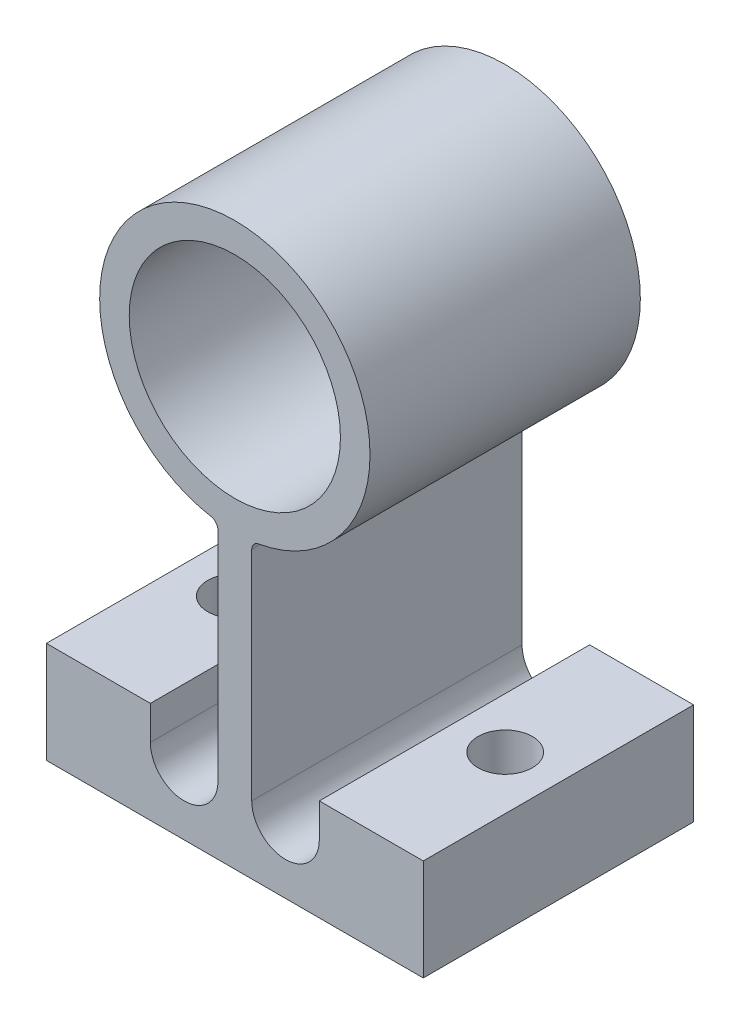
from build123d import *

# Parameters (mm, degrees)
SKETCH1_R                  = 9.921875
EXTRUDE1_DEPTH             = 12.7
BUSHING_SIDE_FILLETS_R     = 0.79375
MOUNT_SIDE_FILLETS_R       = 0.79375
F_1_4_MOUNTING_HOLES_D     = 5.1054
F_1_4_MOUNTING_HOLES_DEPTH = 19.05
F_1_4_MOUNTING_HOLES_TIP   = 1.533816902
EXTRUDE2_DEPTH             = 51.649420448


with BuildPart() as part:
    # Sketch1 → Extrude1 (new, symmetric)
    with BuildSketch(Plane(origin=(0, 0, 0), x_dir=(1, 0, 0), z_dir=(0, 0, -1))):
        with BuildLine():
            Line((-17.705953405, 40.0837), (17.705953405, 40.0837))
            Line((17.705953405, 40.0837), (17.705953405, 30.5587))
            Line((17.705953405, 30.5587), (1.5875, 30.5587))
            Line((1.5875, 30.5587), (1.5875, 12.600390619))
            ThreePointArc((1.5875, 12.600390619), (0, -12.7), (-1.5875, 12.600390619))
            Line((-1.5875, 12.600390619), (-1.5875, 30.5587))
            Line((-1.5875, 30.5587), (-17.705953405, 30.5587))
            Line((-17.705953405, 30.5587), (-17.705953405, 40.0837))
        make_face()
        Circle(SKETCH1_R, mode=Mode.SUBTRACT)
    extrude(amount=EXTRUDE1_DEPTH, both=True)

    # Bushing-side fillets
    bushing_side_fillets_edges = [part.edges().sort_by_distance(p)[0] for p in [
        (1.5875, -12.600390619, 0),
        (-1.5875, -12.600390619, 0),
    ]]
    fillet(bushing_side_fillets_edges, radius=BUSHING_SIDE_FILLETS_R)

    # Mount-side fillets
    mount_side_fillets_edges = [part.edges().sort_by_distance(p)[0] for p in [
        (1.5875, -30.5587, 0),
        (-1.5875, -30.5587, 0),
    ]]
    fillet(mount_side_fillets_edges, radius=MOUNT_SIDE_FILLETS_R)

    # 1/4 Mounting holes
    with Locations(Plane.XZ.offset(40.0837)):
        with Locations((-12.7, 0), (12.7, 0)):
            Hole(F_1_4_MOUNTING_HOLES_D / 2, depth=F_1_4_MOUNTING_HOLES_DEPTH)
            with Locations((0, 0, -(F_1_4_MOUNTING_HOLES_DEPTH + F_1_4_MOUNTING_HOLES_TIP / 2))):  # 118° drill point
                Cone(0, F_1_4_MOUNTING_HOLES_D / 2, F_1_4_MOUNTING_HOLES_TIP, mode=Mode.SUBTRACT)

    # Sketch4 → Extrude2 (cut, through all)
    with BuildSketch(Plane(origin=(0, 0, -12.7), x_dir=(-1, 0, 0), z_dir=(0, 0, -1))):
        with BuildLine():
            Line((1.5875, -29.76495), (1.5875, -33.7337))
            ThreePointArc((1.5875, -33.7337), (4.7625, -36.9087), (7.9375, -33.7337))
            Line((7.9375, -33.7337), (7.9375, -30.5587))
            Line((7.9375, -30.5587), (2.38125, -30.5587))
            ThreePointArc((2.38125, -30.5587), (1.819983992, -30.326216008), (1.5875, -29.76495))
        make_face()
        with BuildLine():
            Line((-7.9375, -30.5587), (-2.38125, -30.5587))
            ThreePointArc((-2.38125, -30.5587), (-1.819983992, -30.326216008), (-1.5875, -29.76495))
            Line((-1.5875, -29.76495), (-1.5875, -33.7337))
            ThreePointArc((-1.5875, -33.7337), (-4.7625, -36.9087), (-7.9375, -33.7337))
            Line((-7.9375, -33.7337), (-7.9375, -30.5587))
        make_face()
    extrude(amount=-EXTRUDE2_DEPTH, mode=Mode.SUBTRACT)


solid = part.part
